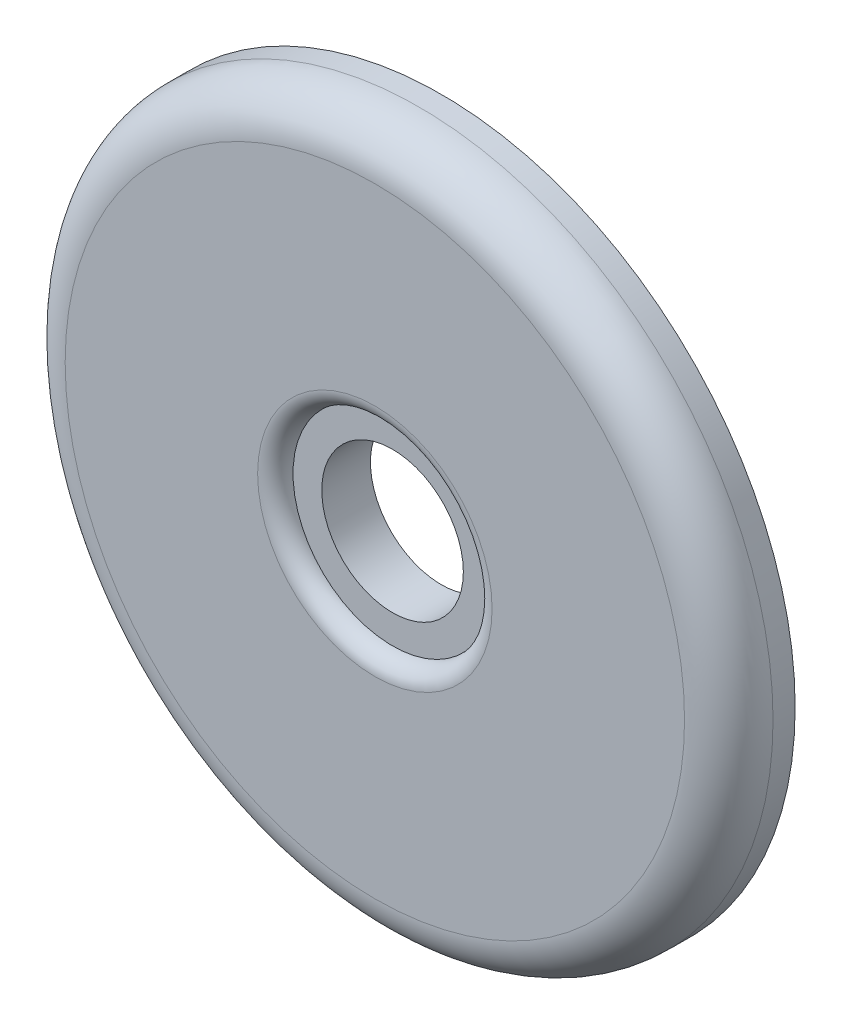
from build123d import *

# Parameters (mm, degrees)
SKETCH_1_R          = 8
SKETCH_1_R_2        = 1.6
EXTRUDE_1_DEPTH     = 1.5
FILLET_1_R          = 1
SKETCH_3_R          = 2.25
CUT_EXTRUDE_3_DEPTH = 0.4
FILLET_2_R          = 0.4


with BuildPart() as part:
    # Эскиз1 → Бобышка-Вытянуть1 (new body)
    with BuildSketch(Plane.XY):
        Circle(SKETCH_1_R)
        Circle(SKETCH_1_R_2, mode=Mode.SUBTRACT)
    extrude(amount=EXTRUDE_1_DEPTH)

    # Скругление1
    fillet_1_edges = [part.edges().sort_by_distance(p)[0] for p in [
        (-8, 0, 1.5),
    ]]
    fillet(fillet_1_edges, radius=FILLET_1_R)

    # Эскиз3 → Вырез-Вытянуть3 (cut)
    with BuildSketch(Plane.XY.offset(1.5)):
        Circle(SKETCH_3_R)
    extrude(amount=-CUT_EXTRUDE_3_DEPTH, mode=Mode.SUBTRACT)

    # Скругление2
    fillet_2_edges = [part.edges().sort_by_distance(p)[0] for p in [
        (-2.25, 0, 1.5),
    ]]
    fillet(fillet_2_edges, radius=FILLET_2_R - 0.0001)  # a hair under: the kernel refuses the full size


solid = part.part
